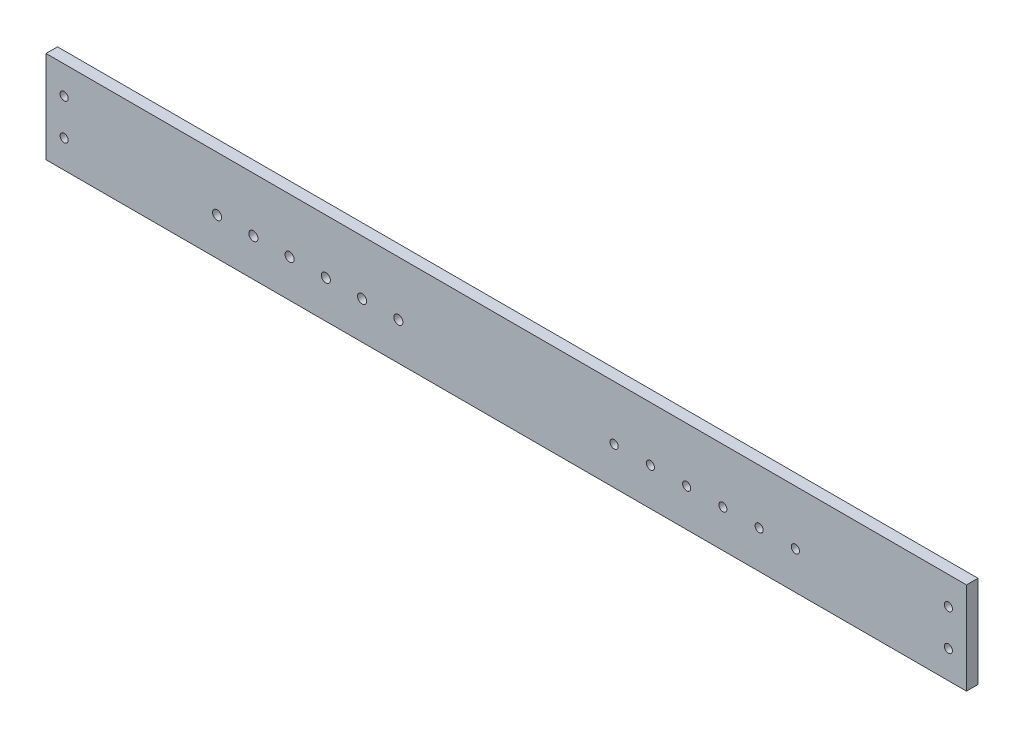
from build123d import *

# Parameters (mm, degrees)
SKETCH1_W           = 254
SKETCH1_H           = 25.4
SKETCH1_R           = 1.125
SKETCH1_R_2         = 1.25
BOSS_EXTRUDE1_DEPTH = 3.175


with BuildPart() as part:
    # Sketch1 → Boss-Extrude1 (new body)
    with BuildSketch(Plane.XY):
        with Locations((-17.549090909, 54.032727273)):
            Rectangle(SKETCH1_W, SKETCH1_H)
        with Locations((-139.549090909, 59.032727273)):
            Circle(SKETCH1_R, mode=Mode.SUBTRACT)
        with Locations((-139.549090909, 49.032727273)):
            Circle(SKETCH1_R, mode=Mode.SUBTRACT)
        with Locations((104.450909091, 59.032727273)):
            Circle(SKETCH1_R, mode=Mode.SUBTRACT)
        with Locations((104.450909091, 49.032727273)):
            Circle(SKETCH1_R, mode=Mode.SUBTRACT)
        with Locations((12.230909091, 51.732727273)):
            Circle(SKETCH1_R, mode=Mode.SUBTRACT)
        with Locations((22.230909091, 51.732727273)):
            Circle(SKETCH1_R, mode=Mode.SUBTRACT)
        with Locations((32.230909091, 51.732727273)):
            Circle(SKETCH1_R, mode=Mode.SUBTRACT)
        with Locations((42.230909091, 51.732727273)):
            Circle(SKETCH1_R, mode=Mode.SUBTRACT)
        with Locations((52.230909091, 51.732727273)):
            Circle(SKETCH1_R, mode=Mode.SUBTRACT)
        with Locations((62.230909091, 51.732727273)):
            Circle(SKETCH1_R, mode=Mode.SUBTRACT)
        with Locations((-97.329090909, 51.732727273)):
            Circle(SKETCH1_R_2, mode=Mode.SUBTRACT)
        with Locations((-87.329090909, 51.732727273)):
            Circle(SKETCH1_R_2, mode=Mode.SUBTRACT)
        with Locations((-77.329090909, 51.732727273)):
            Circle(SKETCH1_R_2, mode=Mode.SUBTRACT)
        with Locations((-67.329090909, 51.732727273)):
            Circle(SKETCH1_R_2, mode=Mode.SUBTRACT)
        with Locations((-57.329090909, 51.732727273)):
            Circle(SKETCH1_R_2, mode=Mode.SUBTRACT)
        with Locations((-47.329090909, 51.732727273)):
            Circle(SKETCH1_R_2, mode=Mode.SUBTRACT)
    extrude(amount=BOSS_EXTRUDE1_DEPTH)


solid = part.part
